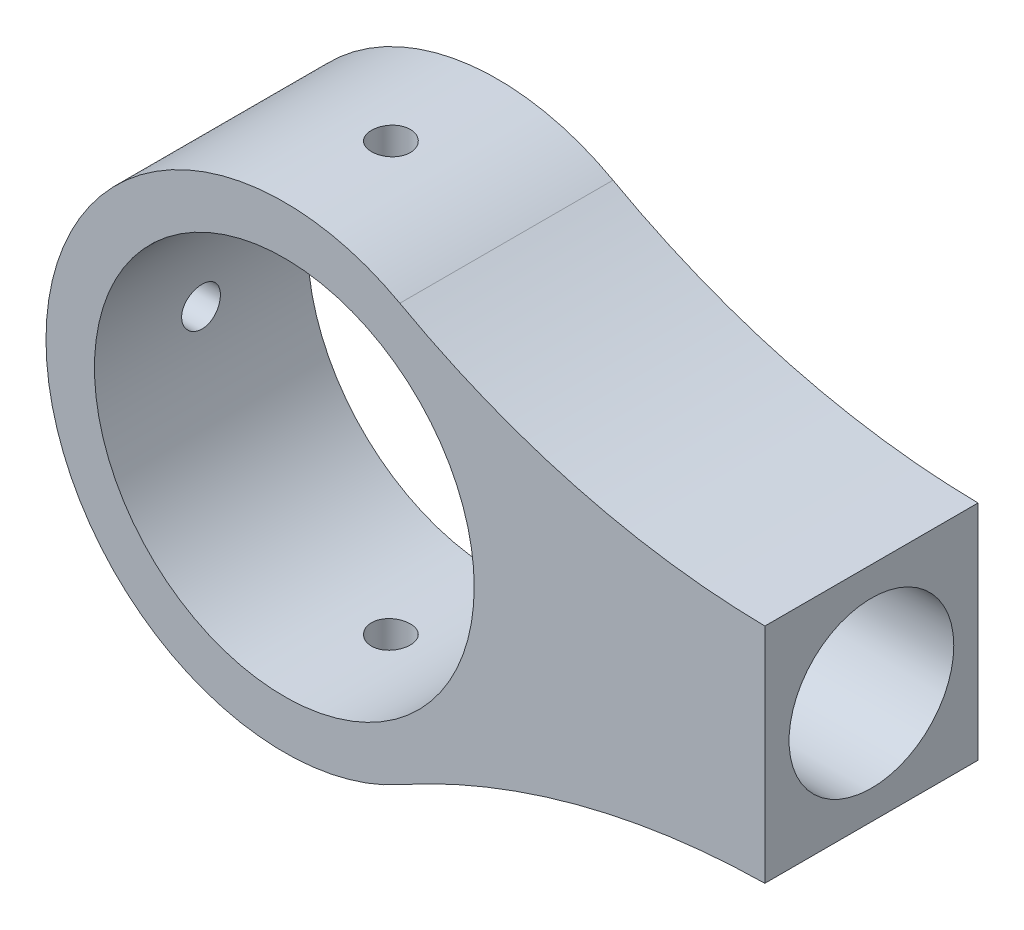
from build123d import *

# Parameters (mm, degrees)
CROQUIS1_R                               = 24.6
CROQUIS1_R_2                             = 19.6
SALIENTE_EXTRUIR1_DEPTH                  = 11
CROQUIS2_W                               = 22
CROQUIS2_H                               = 23
CROQUIS2_R                               = 8.5
SALIENTE_EXTRUIR2_DEPTH                  = 25
SALIENTE_EXTRUIR2_DIRECTION_2_REACH      = 58.096
SALIENTE_EXTRUIR2_DIRECTION_2_END_RADIUS = 24.6
CROQUIS3_R                               = 2
CORTAR_EXTRUIR1_DEPTH                    = 47.5
CROQUIS4_R                               = 2
CORTAR_EXTRUIR2_DEPTH                    = 95
REDONDEO1_R                              = 80


with BuildPart() as part:
    # Croquis1 → Saliente-Extruir1 (new, symmetric)
    with BuildSketch(Plane.XY):
        Circle(CROQUIS1_R)
        Circle(CROQUIS1_R_2, mode=Mode.SUBTRACT)
    extrude(amount=SALIENTE_EXTRUIR1_DEPTH, both=True)

    # Croquis2 → Saliente-Extruir2 (add)
    with BuildSketch(Plane(origin=(24.6, 0, 0), x_dir=(0, 0, -1), z_dir=(1, 0, 0))):
        Rectangle(CROQUIS2_W, CROQUIS2_H)
        Circle(CROQUIS2_R, mode=Mode.SUBTRACT)
    extrude(amount=SALIENTE_EXTRUIR2_DEPTH)

    # Saliente-Extruir2 direction 2: up to this cylinder (the profile starts outside it)
    saliente_extruir2_direction_2_end = Plane(origin=(0, 0, 0), z_dir=(0, 0, -1)) * Cylinder(SALIENTE_EXTRUIR2_DIRECTION_2_END_RADIUS, 166.392, mode=Mode.PRIVATE)
    # Croquis2 → Saliente-Extruir2 direction 2 (add, up to the surface)
    with BuildSketch(Plane(origin=(24.6, 0, 0), x_dir=(0, 0, -1), z_dir=(1, 0, 0)), mode=Mode.PRIVATE) as saliente_extruir2_direction_2_sk1:
        Rectangle(CROQUIS2_W, CROQUIS2_H)
        Circle(CROQUIS2_R, mode=Mode.SUBTRACT)
    saliente_extruir2_direction_2_tool1 = extrude(saliente_extruir2_direction_2_sk1.sketch, amount=-SALIENTE_EXTRUIR2_DIRECTION_2_REACH, mode=Mode.PRIVATE) - saliente_extruir2_direction_2_end
    add(saliente_extruir2_direction_2_tool1.solids().sort_by_distance((24.6, -11.181723, 0))[0])
    add(saliente_extruir2_direction_2_tool1.solids().sort_by_distance((24.6, -11.181723, 0))[1])

    # Croquis3 → Cortar-Extruir1 (cut, symmetric)
    with BuildSketch(Plane(origin=(0, 0, 0), x_dir=(1, 0, 0), z_dir=(0, 1, 0))):
        with Locations(Location((0, 0, 0), (0, 0, 270))):
            Circle(CROQUIS3_R)
    extrude(amount=CORTAR_EXTRUIR1_DEPTH, both=True, mode=Mode.SUBTRACT)

    # Croquis4 → Cortar-Extruir2 (cut)
    with BuildSketch(Plane(origin=(0, 0, 0), x_dir=(0, 0, -1), z_dir=(1, 0, 0))):
        Circle(CROQUIS4_R)
    extrude(amount=-CORTAR_EXTRUIR2_DEPTH, mode=Mode.SUBTRACT)

    # Redondeo1
    # the kernel refuses this fillet: 80 mm, written as the material it adds along each edge
    with BuildSketch(Plane(origin=(21.74649397, 11.5, 11), x_dir=(-0.7001557683573276, 0.713990126007328, 0), z_dir=(0, 0, -1))) as redondeo1_piece_1:
        with BuildLine():
            CenterArc((36.84325364, 76.678287175), REDONDEO1_R, 225.225924333, 28.205393766)
            Line((-19.501792916, 19.88712828), (-20.628693847, 18.751305102))
            ThreePointArc((-20.628693847, 18.751305102), (-10.893280659, 8.823314911), (-1.142384202, -1.120249229))
            Line((-1.142384202, -1.120249229), (0.456263203, -1.533565743))
            ThreePointArc((0.456263203, -1.533565743), (7.015046746, -0.578573306), (13.573830289, -1.533565743))
            Line((13.573830289, -1.533565743), (14.030093492, 0))
        make_face()
    extrude(amount=22)
    with BuildSketch(Plane(origin=(21.74649397, -11.5, 11), x_dir=(-0.7001557683573284, -0.7139901260073274, 0), z_dir=(0, 0, -1))) as redondeo1_piece_2:
        with BuildLine():
            CenterArc((36.84325364, -76.678287175), REDONDEO1_R, 106.568681901, 28.205393766)
            Line((-19.501792916, -19.88712828), (-20.628693847, -18.751305102))
            ThreePointArc((-20.628693847, -18.751305102), (-10.893280659, -8.823314911), (-1.142384202, 1.120249229))
            Line((-1.142384202, 1.120249229), (0.456263203, 1.533565743))
            ThreePointArc((0.456263203, 1.533565743), (7.015046746, 0.578573306), (13.573830289, 1.533565743))
            Line((13.573830289, 1.533565743), (14.030093492, 0))
        make_face()
    extrude(amount=22)


solid = part.part
